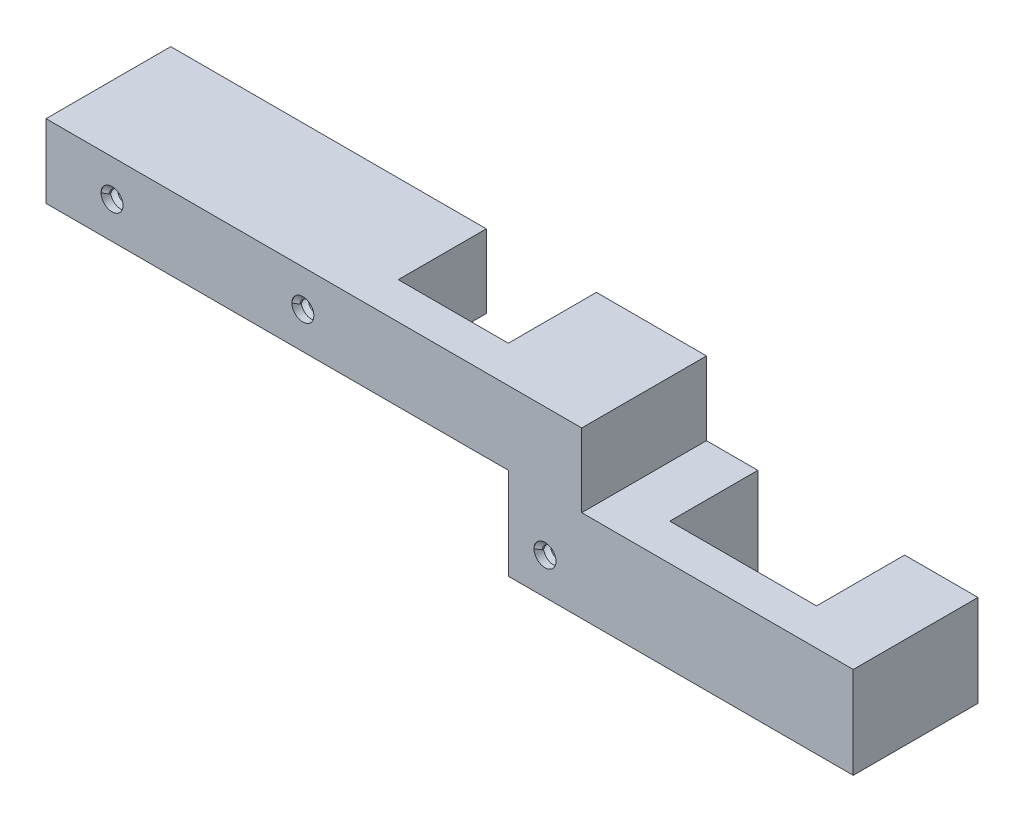
from build123d import *

# Parameters (mm, degrees)
CROQUIS1_R                  = 1.5
SALIENTE_EXTRUIR1_DEPTH     = 17
ROSCA1_PITCH                = 1.25
ROSCA2_PITCH                = 1.25
ROSCA3_PITCH                = 1.25
CORTAR_EXTRUIR1_START       = -22.5
CORTAR_EXTRUIR1_OUTLINE_W   = 15
CORTAR_EXTRUIR1_OUTLINE_H   = 12
CORTAR_EXTRUIR1_OUTLINE_W_2 = 20
CORTAR_EXTRUIR1_DEPTH       = 22.5


with BuildPart() as part:
    # Croquis1 → Saliente-Extruir1 (new body)
    with BuildSketch(Plane.XY):
        Polygon((-66.62601626, 7.737127371), (-3.62601626, 7.737127371), (-3.62601626, -4.762872629), (43.37398374, -4.762872629), (43.37398374, 7.737127371), (6.37398374, 7.737127371), (6.37398374, 17.737127371), (-66.62601626, 17.737127371), align=None)
        with Locations((-31.62601626, 12.737127371)):
            Circle(CROQUIS1_R, mode=Mode.SUBTRACT)
        with Locations((-57.62601626, 12.737127371)):
            Circle(CROQUIS1_R, mode=Mode.SUBTRACT)
        with Locations((1.37398374, 0.237127371)):
            Circle(CROQUIS1_R, mode=Mode.SUBTRACT)
    extrude(amount=SALIENTE_EXTRUIR1_DEPTH)

    # Rosca1: arcs per turn and ends read off the stored shape
    # Rosca1: the profile of Perfil de rosca1 profile screwed along a right-hand helix through 12 turns, 8 arcs to a turn; built about Z, then put on its axis
    rosca1_z = Axis((0, 0, 0), (0, 0, 1))
    rosca1_corners = [(1.5003, 0, -0.000173205), (1.5003, 0, 1.093923202), (0.823417656, 0, 0.703124998), (0.823417656, 0, 0.390624998)]
    with BuildLine(mode=Mode.PRIVATE) as rosca1_profile:
        Line(rosca1_corners[0], rosca1_corners[1])
        Line(rosca1_corners[1], rosca1_corners[2])
        Line(rosca1_corners[2], rosca1_corners[3])
        Line(rosca1_corners[3], rosca1_corners[0])
    rosca1_cap = Face(rosca1_profile.wire())
    rosca1_turn_angles = [0, 22.5, 45, 67.5, 90, 112.5, 135, 157.5, 180, 202.5, 225, 247.5, 270, 292.5, 315, 337.5, 360]
    rosca1_turn_weights = [1, 0.9238795325112867, 1, 0.9238795325112867, 1, 0.9238795325112867, 1, 0.9238795325112867, 1, 0.9238795325112867, 1, 0.9238795325112867, 1, 0.9238795325112867, 1, 0.9238795325112867, 1]
    rosca1_turn_rails = [Edge.make_bspline([Vector(p[0], p[1], 0).rotate(rosca1_z, rosca1_turn_angles[k]) / rosca1_turn_weights[k] + Vector(0, 0, p[2] + ROSCA1_PITCH * rosca1_turn_angles[k] / 360) for k in range(17)], [0, 0, 0, 1, 1, 2, 2, 3, 3, 4, 4, 5, 5, 6, 6, 7, 7, 8, 8, 8], 2, rosca1_turn_weights) for p in rosca1_corners]
    rosca1_turn_sides = [Face.make_surface_from_curves(rosca1_turn_rails[p[0]], rosca1_turn_rails[p[1]]) for p in [(0, 1), (1, 2), (2, 3), (3, 0)]]
    rosca1 = Plane(origin=(-31.62601626, 12.737127371, 17), x_dir=(-1, 0, 0), z_dir=(0, 0, -1)) * Solid(Shell([*[p.moved(Location((0, 0, ROSCA1_PITCH * i))) for i in range(12) for p in rosca1_turn_sides], rosca1_cap, rosca1_cap.rotate(rosca1_z, 4320).moved(Location((0, 0, ROSCA1_PITCH * 4320 / 360)))]))
    add(rosca1)

    # Rosca2: arcs per turn and ends read off the stored shape
    # Rosca2: the profile of Perfil de rosca2 profile screwed along a right-hand helix through 12 turns, 8 arcs to a turn; built about Z, then put on its axis
    rosca2_z = Axis((0, 0, 0), (0, 0, 1))
    rosca2_corners = [(1.5003, 0, -0.000173205), (1.5003, 0, 1.093923202), (0.823417656, 0, 0.703124998), (0.823417656, 0, 0.390624998)]
    with BuildLine(mode=Mode.PRIVATE) as rosca2_profile:
        Line(rosca2_corners[0], rosca2_corners[1])
        Line(rosca2_corners[1], rosca2_corners[2])
        Line(rosca2_corners[2], rosca2_corners[3])
        Line(rosca2_corners[3], rosca2_corners[0])
    rosca2_cap = Face(rosca2_profile.wire())
    rosca2_turn_angles = [0, 22.5, 45, 67.5, 90, 112.5, 135, 157.5, 180, 202.5, 225, 247.5, 270, 292.5, 315, 337.5, 360]
    rosca2_turn_weights = [1, 0.9238795325112867, 1, 0.9238795325112867, 1, 0.9238795325112867, 1, 0.9238795325112867, 1, 0.9238795325112867, 1, 0.9238795325112867, 1, 0.9238795325112867, 1, 0.9238795325112867, 1]
    rosca2_turn_rails = [Edge.make_bspline([Vector(p[0], p[1], 0).rotate(rosca2_z, rosca2_turn_angles[k]) / rosca2_turn_weights[k] + Vector(0, 0, p[2] + ROSCA2_PITCH * rosca2_turn_angles[k] / 360) for k in range(17)], [0, 0, 0, 1, 1, 2, 2, 3, 3, 4, 4, 5, 5, 6, 6, 7, 7, 8, 8, 8], 2, rosca2_turn_weights) for p in rosca2_corners]
    rosca2_turn_sides = [Face.make_surface_from_curves(rosca2_turn_rails[p[0]], rosca2_turn_rails[p[1]]) for p in [(0, 1), (1, 2), (2, 3), (3, 0)]]
    rosca2 = Plane(origin=(-57.62601626, 12.737127371, 17), x_dir=(-1, 0, 0), z_dir=(0, 0, -1)) * Solid(Shell([*[p.moved(Location((0, 0, ROSCA2_PITCH * i))) for i in range(12) for p in rosca2_turn_sides], rosca2_cap, rosca2_cap.rotate(rosca2_z, 4320).moved(Location((0, 0, ROSCA2_PITCH * 4320 / 360)))]))
    add(rosca2)

    # Rosca3: arcs per turn and ends read off the stored shape
    # Rosca3: the profile of Perfil de rosca3 profile screwed along a right-hand helix through 12 turns, 8 arcs to a turn; built about Z, then put on its axis
    rosca3_z = Axis((0, 0, 0), (0, 0, 1))
    rosca3_corners = [(1.5003, 0, -0.000173205), (1.5003, 0, 1.093923202), (0.823417656, 0, 0.703124998), (0.823417656, 0, 0.390624998)]
    with BuildLine(mode=Mode.PRIVATE) as rosca3_profile:
        Line(rosca3_corners[0], rosca3_corners[1])
        Line(rosca3_corners[1], rosca3_corners[2])
        Line(rosca3_corners[2], rosca3_corners[3])
        Line(rosca3_corners[3], rosca3_corners[0])
    rosca3_cap = Face(rosca3_profile.wire())
    rosca3_turn_angles = [0, 22.5, 45, 67.5, 90, 112.5, 135, 157.5, 180, 202.5, 225, 247.5, 270, 292.5, 315, 337.5, 360]
    rosca3_turn_weights = [1, 0.9238795325112867, 1, 0.9238795325112867, 1, 0.9238795325112867, 1, 0.9238795325112867, 1, 0.9238795325112867, 1, 0.9238795325112867, 1, 0.9238795325112867, 1, 0.9238795325112867, 1]
    rosca3_turn_rails = [Edge.make_bspline([Vector(p[0], p[1], 0).rotate(rosca3_z, rosca3_turn_angles[k]) / rosca3_turn_weights[k] + Vector(0, 0, p[2] + ROSCA3_PITCH * rosca3_turn_angles[k] / 360) for k in range(17)], [0, 0, 0, 1, 1, 2, 2, 3, 3, 4, 4, 5, 5, 6, 6, 7, 7, 8, 8, 8], 2, rosca3_turn_weights) for p in rosca3_corners]
    rosca3_turn_sides = [Face.make_surface_from_curves(rosca3_turn_rails[p[0]], rosca3_turn_rails[p[1]]) for p in [(0, 1), (1, 2), (2, 3), (3, 0)]]
    rosca3 = Plane(origin=(1.37398374, 0.237127371, 17), x_dir=(-1, 0, 0), z_dir=(0, 0, -1)) * Solid(Shell([*[p.moved(Location((0, 0, ROSCA3_PITCH * i))) for i in range(12) for p in rosca3_turn_sides], rosca3_cap, rosca3_cap.rotate(rosca3_z, 4320).moved(Location((0, 0, ROSCA3_PITCH * 4320 / 360)))]))
    add(rosca3)

    # Cortar-Extruir1: read off the stored shape, not the designer's step
    # Cortar-Extruir1 outline → Cortar-Extruir1 (cut)
    with BuildSketch(Plane.XZ.offset(4.762872629).offset(CORTAR_EXTRUIR1_START)):
        with Locations((-16.12601626, 6)):
            Rectangle(CORTAR_EXTRUIR1_OUTLINE_W, CORTAR_EXTRUIR1_OUTLINE_H)
        with Locations((23.37398374, 6)):
            Rectangle(CORTAR_EXTRUIR1_OUTLINE_W_2, CORTAR_EXTRUIR1_OUTLINE_H)
    extrude(amount=CORTAR_EXTRUIR1_DEPTH, mode=Mode.SUBTRACT)


solid = part.part
